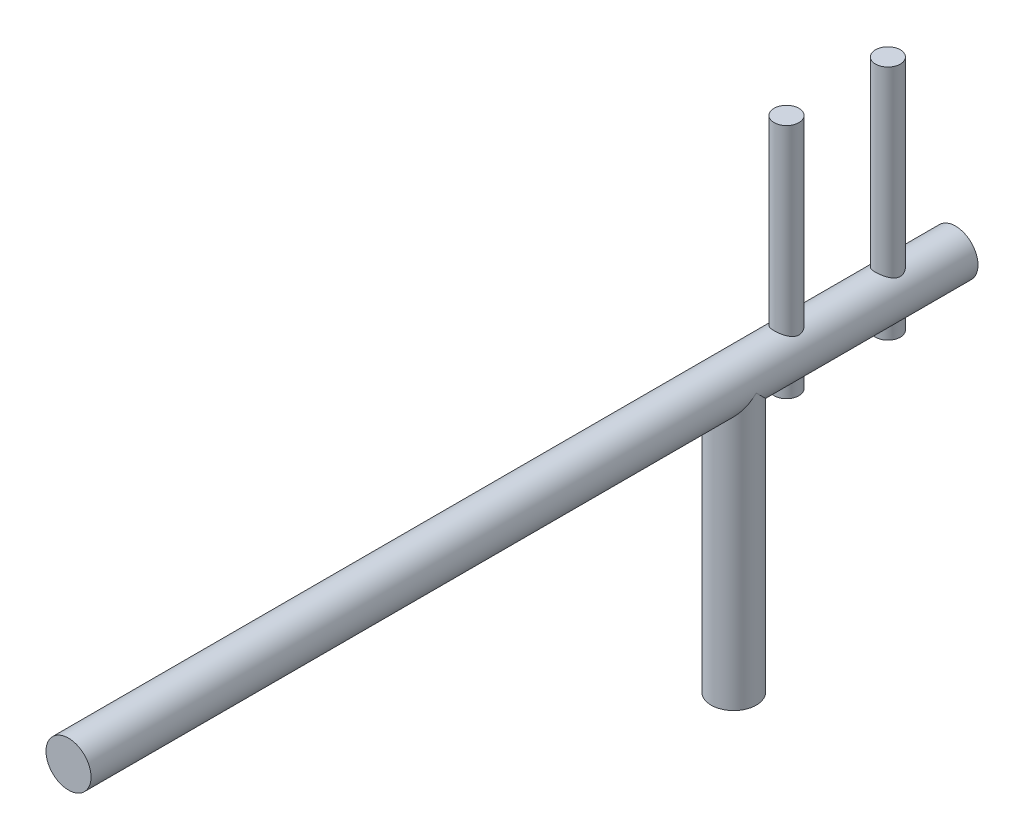
from build123d import *

# Parameters (mm, degrees)
SKETCH1_R                = 6.35
BOSS_EXTRUDE1_DEPTH      = 76.2
BOSS_EXTRUDE2_DEPTH      = 187.5
BOSS_EXTRUDE2_DEPTH_BACK = 62.5
SKETCH2_R                = 6.35
BOSS_EXTRUDE3_START      = 66.675
SKETCH3_R                = 3.5
BOSS_EXTRUDE3_DEPTH      = 66.675


with BuildPart() as part:
    # Sketch1 → Boss-Extrude1 (new body)
    with BuildSketch(Plane(origin=(0, 0, 0), x_dir=(1, 0, 0), z_dir=(0, 1, 0))):
        Circle(SKETCH1_R)
    extrude(amount=BOSS_EXTRUDE1_DEPTH)

    # Sketch2 → Boss-Extrude2 (add, two sides: drawn at the far end of the back side and taken through both)
    with BuildSketch(Plane.XY.offset(-BOSS_EXTRUDE2_DEPTH_BACK)):
        with Locations((0, 76.2)):
            Circle(SKETCH2_R)
    extrude(amount=BOSS_EXTRUDE2_DEPTH + BOSS_EXTRUDE2_DEPTH_BACK)

    # Sketch3 → Boss-Extrude3 (add)
    with BuildSketch(Plane(origin=(0, 0, 0), x_dir=(1, 0, 0), z_dir=(0, 1, 0)).offset(BOSS_EXTRUDE3_START)):
        with Locations((0, 14.875)):
            Circle(SKETCH3_R)
        with Locations((0, 43.45)):
            Circle(SKETCH3_R)
    extrude(amount=BOSS_EXTRUDE3_DEPTH)


solid = part.part
